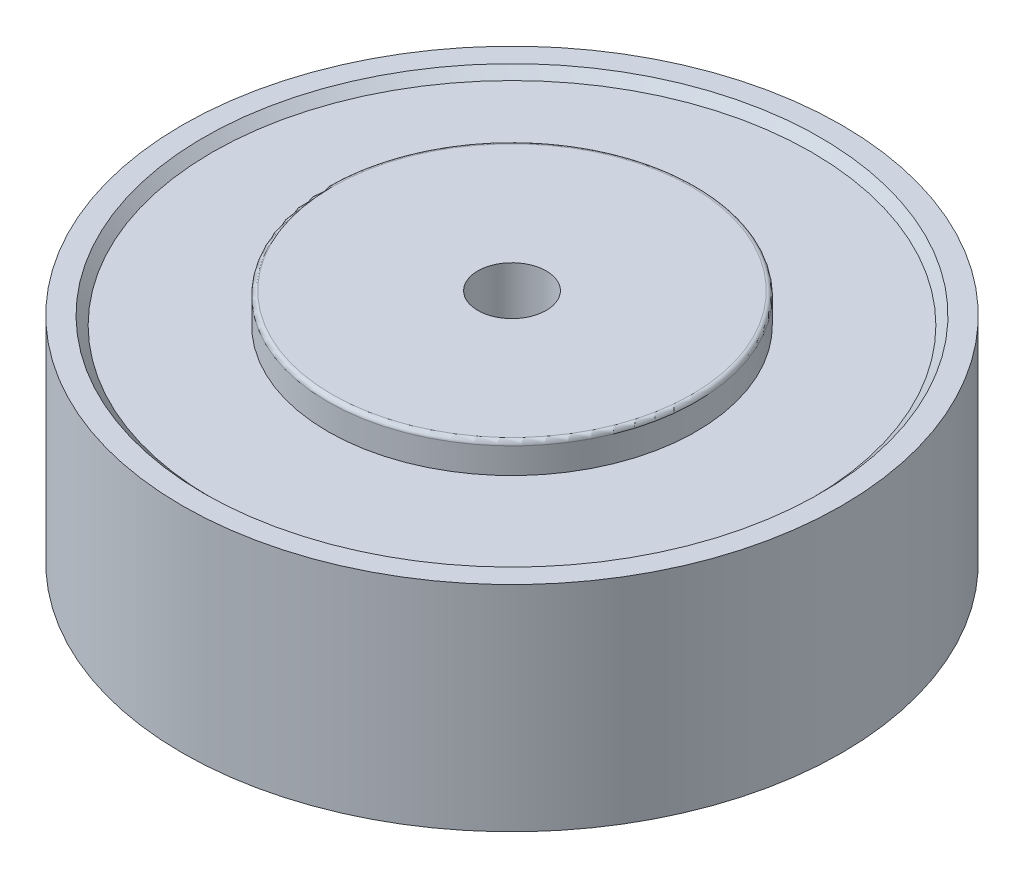
from build123d import *

# Parameters (mm, degrees)
EXTRUDE_1_DEPTH     = 25
CUT_EXTRUDE_3_DEPTH = 1
CUT_EXTRUDE_START   = -1
CUT_EXTRUDE_4_DEPTH = 1
CHAMFER_1_SIZE      = 1
EXTRUDE_2_DEPTH     = 3.5
EXTRUDE_START       = 3.5
EXTRUDE_3_DEPTH     = 3.5
FILLET_1_R          = 0.5
SKETCH_6_R          = 4
CUT_EXTRUDE_5_DEPTH = 63.165102751


with BuildPart() as part:
    # ｽｹｯﾁ1 → ﾎﾞｽ - 押し出し1 (new body)
    with BuildSketch(Plane(origin=(0, 0, 0), x_dir=(1, 0, 0), z_dir=(0, 1, 0))):
        with BuildLine():
            ThreePointArc((35.980947353, 13.697497128), (22.958239241, 30.905812576), (2.722143787, 38.403644791))
            ThreePointArc((2.722143787, 38.403644791), (-28.169598292, -26.243546485), (38.5, 0))
            ThreePointArc((38.5, 0), (37.865000153, 6.963602764), (35.980947353, 13.697497128))
        make_face()
    extrude(amount=EXTRUDE_1_DEPTH)

    # ｽｹｯﾁ2 → ｶｯﾄ - 押し出し3 (cut)
    with BuildSketch(Plane(origin=(0, 25, 0), x_dir=(1, 0, 0), z_dir=(0, 1, 0))):
        with BuildLine():
            ThreePointArc((34.036718994, 11.726114452), (21.467444485, 28.898941629), (1.396281143, 35.972912017))
            ThreePointArc((1.396281143, 35.972912017), (-25.94480797, -24.957302327), (36, 0))
            ThreePointArc((36, 0), (35.505787442, 5.944666358), (34.036718994, 11.726114452))
        make_face()
    extrude(amount=-CUT_EXTRUDE_3_DEPTH, mode=Mode.SUBTRACT)

    # ｽｹｯﾁ3 → ｶｯﾄ - 押し出し4 (cut)
    with BuildSketch(Plane.XZ.offset(CUT_EXTRUDE_START)):
        with BuildLine():
            ThreePointArc((34.036718994, 11.726114452), (21.467444485, 28.898941629), (1.396281143, 35.972912017))
            ThreePointArc((1.396281143, 35.972912017), (-25.94480797, -24.957302327), (36, 0))
            ThreePointArc((36, 0), (35.505787442, 5.944666358), (34.036718994, 11.726114452))
        make_face()
    extrude(amount=CUT_EXTRUDE_4_DEPTH, mode=Mode.SUBTRACT)

    # 面取り1
    chamfer_1_edges = [part.edges().sort_by_distance(p)[0] for p in [
        (-36, 1, 0),
        (-36, 24, 0),
    ]]
    chamfer(chamfer_1_edges, length=CHAMFER_1_SIZE - 0.0001)  # a hair under: the kernel refuses the full size

    # ｽｹｯﾁ4 → ﾎﾞｽ - 押し出し2 (add)
    with BuildSketch(Plane.XZ.offset(-1)):
        with BuildLine():
            ThreePointArc((21.5, 0), (11.339952646, 18.266238638), (-9.537718509, 19.268677319))
            ThreePointArc((-9.537718509, 19.268677319), (-12.820834901, -17.25909014), (21.202158445, -3.566297417))
            ThreePointArc((21.202158445, -3.566297417), (21.425410224, -1.789356508), (21.5, 0))
        make_face()
    extrude(amount=EXTRUDE_2_DEPTH)

    # ｽｹｯﾁ5 → ﾎﾞｽ - 押し出し3 (add)
    with BuildSketch(Plane(origin=(0, 24, 0), x_dir=(1, 0, 0), z_dir=(0, 1, 0)).offset(EXTRUDE_START)):
        with BuildLine():
            ThreePointArc((21.5, 0), (11.339952646, 18.266238638), (-9.537718509, 19.268677319))
            ThreePointArc((-9.537718509, 19.268677319), (-12.820834901, -17.25909014), (21.202158445, -3.566297417))
            ThreePointArc((21.202158445, -3.566297417), (21.425410224, -1.789356508), (21.5, 0))
        make_face()
    extrude(amount=-EXTRUDE_3_DEPTH)

    # ﾌｨﾚｯﾄ1
    fillet_1_edges = [part.edges().sort_by_distance(p)[0] for p in [
        (-21.202158445, -2.5, 3.566297417),
        (-21.202158445, 27.5, -3.566297417),
    ]]
    fillet(fillet_1_edges, radius=FILLET_1_R)

    # ｽｹｯﾁ6 → ｶｯﾄ - 押し出し5 (cut, through all)
    with BuildSketch(Plane.XZ.offset(2.5)):
        with Locations(Location((0, 0, 0), (0, 0, 270))):
            Circle(SKETCH_6_R)
    extrude(amount=-CUT_EXTRUDE_5_DEPTH, mode=Mode.SUBTRACT)


solid = part.part
